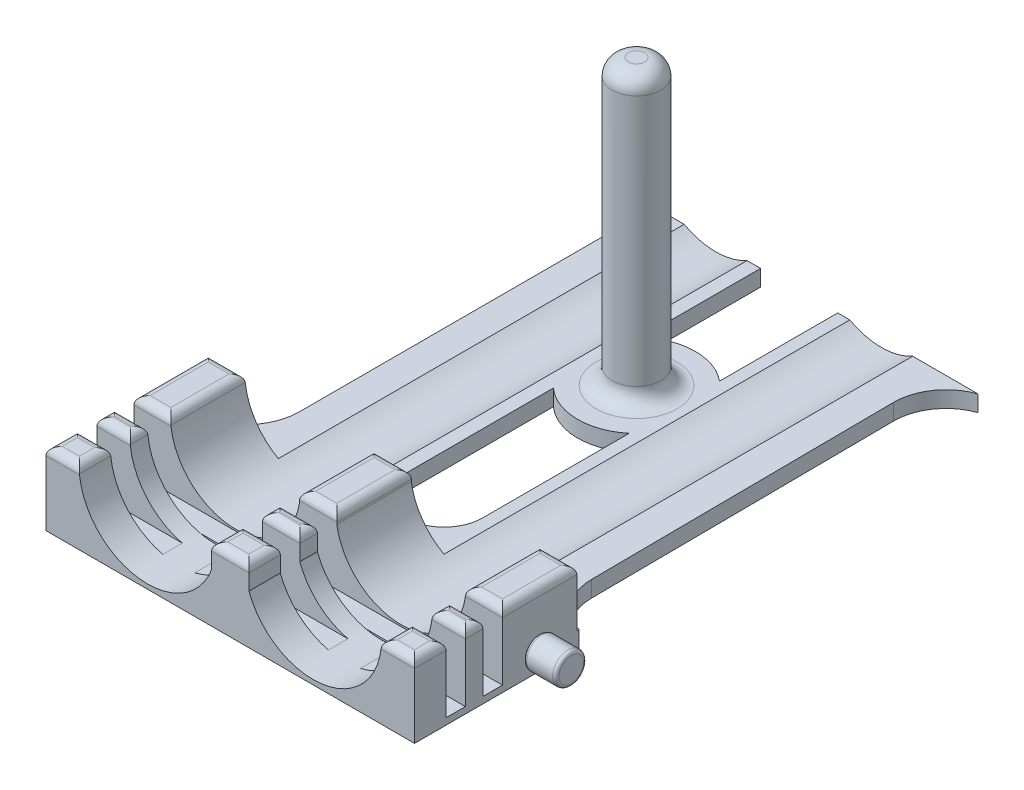
from build123d import *

# Parameters (mm, degrees)
SKETCH1_W           = 25
SKETCH1_H           = 90
BOSS_EXTRUDE1_DEPTH = 9
SKETCH4_W           = 8
SKETCH4_H           = 71
SKETCH5_W           = 25
SKETCH5_H           = 2.4
SKETCH5_W_2         = 28
FLANGE_SLOT_DEPTH   = 8.2
SKETCH6_W           = 8.432931683
SKETCH6_H           = 8.432931683
SKETCH18_W          = 25
SKETCH18_H          = 50
SYRINGE_BAY_DEPTH   = 7
SKETCH26_W          = 38.352553791
SKETCH26_H          = 20.215566654
CUT_EXTRUDE14_DEPTH = 10
LPATTERN3_COUNT     = 2
LPATTERN3_PITCH     = 20.4
SKETCH31_R          = 1.9
CUT_EXTRUDE16_DEPTH = 4
SKETCH33_R          = 1.9
BOSS_EXTRUDE2_DEPTH = 4
FILLET1_R           = 0.4
FILLET2_R           = 0.6
CUT_EXTRUDE17_DEPTH = 10
SKETCH36_R          = 3
BOSS_EXTRUDE3_DEPTH = 35
FILLET5_R           = 2
FILLET7_R           = 1


with BuildPart() as part:
    # Sketch1 → Boss-Extrude1 (new body)
    with BuildSketch(Plane(origin=(0, 0, 0), x_dir=(1, 0, 0), z_dir=(0, 1, 0))):
        Rectangle(SKETCH1_W, SKETCH1_H)
    extrude(amount=BOSS_EXTRUDE1_DEPTH)

    # Sketch4 → Syringe Body slot (revolve, cut)
    with BuildSketch(Plane(origin=(0, 9, 0), x_dir=(1, 0, 0), z_dir=(0, 1, 0))):
        with Locations((-4, 1.3)):
            Rectangle(SKETCH4_W, SKETCH4_H)
    revolve(axis=Axis((0, 9, -36.8), (0, 0, 1)), mode=Mode.SUBTRACT)

    # Sketch5 → Flange Slot (cut)
    with BuildSketch(Plane(origin=(0, 9, 0), x_dir=(1, 0, 0), z_dir=(0, 1, 0))):
        with Locations((0, -35.367068317)):
            Rectangle(SKETCH5_W, SKETCH5_H)
        with Locations((0, -39.936134865)):
            Rectangle(SKETCH5_W_2, SKETCH5_H)
    extrude(amount=-FLANGE_SLOT_DEPTH, mode=Mode.SUBTRACT)

    # Sketch6 → Plunger Slot (revolve, cut)
    with BuildSketch(Plane(origin=(0, 9, 0), x_dir=(1, 0, 0), z_dir=(0, 1, 0))):
        with Locations((-4.216465842, -40.783534159)):
            Rectangle(SKETCH6_W, SKETCH6_H)
    revolve(axis=Axis((0, 9, 45), (0, 0, -1)), mode=Mode.SUBTRACT)

    # Sketch18 → Syringe Bay (cut)
    with BuildSketch(Plane(origin=(0, 9, 0), x_dir=(1, 0, 0), z_dir=(0, 1, 0))):
        Rectangle(SKETCH18_W, SKETCH18_H)
    extrude(amount=-SYRINGE_BAY_DEPTH, mode=Mode.SUBTRACT)

    # Sketch26 → Cut-Extrude14 (cut)
    with BuildSketch(Plane(origin=(0, 9, 0), x_dir=(1, 0, 0), z_dir=(0, 1, 0))):
        with Locations((-0.72363309, 35.107783327)):
            Rectangle(SKETCH26_W, SKETCH26_H)
    extrude(amount=-CUT_EXTRUDE14_DEPTH, mode=Mode.SUBTRACT)


with BuildPart() as lpattern3_1:
    # LPattern3: pattern copy
    add(part.part.moved(Location(Vector(1, 0, 0) * (1 * LPATTERN3_PITCH))))


with BuildPart() as part_1:
    add(part.part)

    # Sketch31 → Cut-Extrude16 (cut)
    with BuildSketch(Plane.ZY.offset(12.5)):
        with Locations((29.687280392, 2.231257616)):
            Circle(SKETCH31_R)
    extrude(amount=-CUT_EXTRUDE16_DEPTH, mode=Mode.SUBTRACT)

    # Fillet2
    # the kernel refuses this fillet: 0.6 mm, written as the material it adds along each edge
    with BuildSketch(Plane(origin=(-8.5, 2.231257616, 29.687280392), x_dir=(0, 0, 1), z_dir=(0, -1, 0))) as fillet2_piece_1:
        with BuildLine():
            CenterArc((1.9 - FILLET2_R, FILLET2_R), FILLET2_R, 270, 90)
            Line((1.9 - FILLET2_R, 0), (1.9, 0))
            Line((1.9, 0), (1.9, FILLET2_R))
        make_face()
    revolve(axis=Axis((-8.5, 2.231257616, 29.687280392), (-1, 0, 0)))
    # the kernel refuses this fillet: 0.6 mm, written as the material it takes off along each edge
    with BuildSketch(Plane(origin=(-12.5, 2.231257616, 29.687280392), x_dir=(0, 0, 1), z_dir=(0, -1, 0))) as fillet2_2_piece_1:
        with BuildLine():
            CenterArc((1.9 + FILLET2_R, -FILLET2_R), FILLET2_R, 90, 90)
            Line((1.9, -FILLET2_R), (1.9, 0))
            Line((1.9, 0), (1.9 + FILLET2_R, 0))
        make_face()
    revolve(axis=Axis((-12.5, 2.231257616, 29.687280392), (-1, 0, 0)), mode=Mode.SUBTRACT)


with BuildPart() as body_3:
    # Sketch33 → Boss-Extrude2 (new body)
    with BuildSketch(Plane(origin=(32.9, 0, 0), x_dir=(0, 0, -1), z_dir=(1, 0, 0))):
        with Locations((-29.687280392, 2.231257616)):
            Circle(SKETCH33_R)
    extrude(amount=BOSS_EXTRUDE2_DEPTH)

    # Fillet1
    fillet1_edges = [body_3.edges().sort_by_distance(p)[0] for p in [
        (32.9, 2.231257616, 31.587280392),
        (36.9, 2.231257616, 31.587280392),
    ]]
    fillet(fillet1_edges, radius=FILLET1_R)


with BuildPart() as cut_extrude17_tool:
    # Sketch35 → Cut-Extrude17 (new body)
    with BuildSketch(Plane(origin=(0, 2, 0), x_dir=(1, 0, 0), z_dir=(0, 1, 0))):
        with BuildLine():
            Line((-7.572519934, 18.75), (-7.572519934, -18.75))
            ThreePointArc((-7.572519934, -18.75), (-14, -25.177480066), (-20.427480066, -18.75))
            Line((-20.427480066, -18.75), (-20.427480066, 18.75))
            ThreePointArc((-20.427480066, 18.75), (-14, 25.177480066), (-7.572519934, 18.75))
        make_face()
        with BuildLine():
            Line((15.038012539, 25.284497927), (15.038012539, 10.435091669))
            ThreePointArc((15.038012539, 10.435091669), (10.258664257, 12.127791533), (5.538012539, 10.277696889))
            Line((5.538012539, 10.277696889), (5.538012539, 25.284497927))
            ThreePointArc((5.538012539, 25.284497927), (10.288012539, 30.034497927), (15.038012539, 25.284497927))
        make_face()
        with BuildLine():
            Line((28.019587368, 18.885486869), (28.305082347, -18.61342635))
            ThreePointArc((28.305082347, -18.61342635), (34.781309827, -24.991786455), (41.159669932, -18.515558975))
            Line((41.159669932, -18.515558975), (40.874174953, 18.983354244))
            ThreePointArc((40.874174953, 18.983354244), (34.397947473, 25.361714349), (28.019587368, 18.885486869))
        make_face()
        with BuildLine():
            Line((15.038012539, -0.688026199), (15.038012539, -18.75))
            ThreePointArc((15.038012539, -18.75), (10.288012539, -23.5), (5.538012539, -18.75))
            Line((5.538012539, -18.75), (5.538012539, -0.530631419))
            ThreePointArc((5.538012539, -0.530631419), (10.258664257, -2.380726063), (15.038012539, -0.688026199))
        make_face()
    extrude(amount=-CUT_EXTRUDE17_DEPTH)


with BuildPart() as part_2:
    add(part_1.part)

    # Cut-Extrude17: cut by cut_extrude17_tool
    add(cut_extrude17_tool.part, mode=Mode.SUBTRACT)


with BuildPart() as lpattern3_1_1:
    add(lpattern3_1.part)

    # Cut-Extrude17: cut by cut_extrude17_tool
    add(cut_extrude17_tool.part, mode=Mode.SUBTRACT)

    # Combine2: union part, body 3
    add(part_2.part)
    add(body_3.part)

    # Sketch36 → Boss-Extrude3 (add)
    with BuildSketch(Plane(origin=(0, 2, 0), x_dir=(1, 0, 0), z_dir=(0, 1, 0))):
        with Locations(Location((10.378851885, 4.873532735, 0), (0, 0, 90))):
            Circle(SKETCH36_R)
    extrude(amount=BOSS_EXTRUDE3_DEPTH)

    # Fillet5
    fillet5_edges = [lpattern3_1_1.edges().sort_by_distance(p)[0] for p in [
        (10.378851885, 2, -1.873532735),
        (10.378851885, 37, -1.873532735),
    ]]
    fillet(fillet5_edges, radius=FILLET5_R)

    # Fillet7
    fillet7_edges = [lpattern3_1_1.edges().sort_by_distance(p)[0] for p in [
        (7.9, 9, 29.583534158),
        (10.2, 9, 25),
        (30.65, 9, 25),
        (10.2, 9, 45),
        (32.9, 9, 37.651601591),
        (32.9, 9, 29.583534158),
        (7.9, 9, 37.651601591),
        (7.9, 9, 43.068067433),
        (10.2, 9, 41.136134865),
        (30.866465842, 9, 38.736134865),
        (-10.25, 9, 34.167068317),
        (12.5, 9, 37.651601591),
        (12.5, 9, 43.068067433),
        (-8.432931683, 9, 37.651601591),
        (-8.432931683, 9, 43.068067433),
        (-12.5, 9, 29.583534158),
        (-8, 9, 29.583534158),
        (12.5, 9, 29.583534158),
        (-12.5, 9, 37.651601591),
        (-12.5, 9, 43.068067433),
        (-10.466465842, 9, 45),
        (-10.466465842, 9, 38.736134865),
        (-10.466465842, 9, 36.567068317),
        (-10.466465842, 9, 41.136134865),
        (-10.25, 9, 25),
        (10.2, 9, 34.167068317),
        (10.2, 9, 36.567068317),
        (30.65, 9, 34.167068317),
        (32.9, 9, 43.068067433),
        (10.2, 9, 38.736134865),
        (30.866465842, 9, 41.136134865),
        (30.866465842, 9, 36.567068317),
        (30.866465842, 9, 45),
        (28.832931683, 9, 37.651601591),
        (28.832931683, 9, 43.068067433),
        (28.4, 9, 29.583534158),
    ]]
    fillet(fillet7_edges, radius=FILLET7_R)


solid = lpattern3_1_1.part
